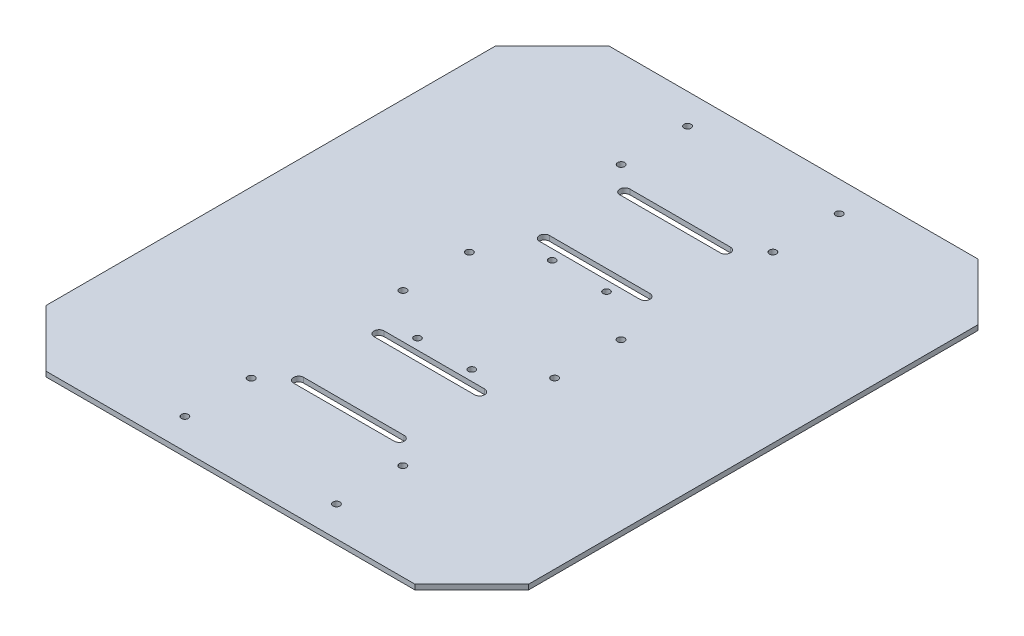
from build123d import *

# Parameters (mm, degrees)
SKETCH1_R           = 2.2225
BOSS_EXTRUDE1_DEPTH = 3.175
SKETCH2_R           = 2.159
CUT_EXTRUDE1_DEPTH  = 297.247830215
CUT_EXTRUDE2_DEPTH  = 297.247830215


with BuildPart() as part:
    # Sketch1 → Boss-Extrude1 (new body)
    with BuildSketch(Plane(origin=(0, 0, 0), x_dir=(1, 0, 0), z_dir=(0, 1, 0))):
        Polygon((-85.365028143, 123.058976948), (-121.286052627, 87.137952464), (-121.286052627, -196.619998567), (-85.365028143, -232.541023052), (147.592922888, -232.541023052), (183.513947373, -196.619998567), (183.513947373, 87.137952464), (147.592922888, 123.058976948), align=None)
        with Locations((-16.765052627, -213.491023052)):
            Circle(SKETCH1_R, mode=Mode.SUBTRACT)
        with Locations((-16.765052627, -171.581023052)):
            Circle(SKETCH1_R, mode=Mode.SUBTRACT)
        with Locations((-16.765052627, -75.696023052)):
            Circle(SKETCH1_R, mode=Mode.SUBTRACT)
        with Locations((78.992947373, -213.491023052)):
            Circle(SKETCH1_R, mode=Mode.SUBTRACT)
        with Locations((78.992947373, -171.581023052)):
            Circle(SKETCH1_R, mode=Mode.SUBTRACT)
        with Locations((78.992947373, -75.696023052)):
            Circle(SKETCH1_R, mode=Mode.SUBTRACT)
        with Locations((-16.765052627, -33.786023052)):
            Circle(SKETCH1_R, mode=Mode.SUBTRACT)
        with Locations((-16.765052627, 62.098976948)):
            Circle(SKETCH1_R, mode=Mode.SUBTRACT)
        with Locations((-16.765052627, 104.008976948)):
            Circle(SKETCH1_R, mode=Mode.SUBTRACT)
        with Locations((78.992947373, -33.786023052)):
            Circle(SKETCH1_R, mode=Mode.SUBTRACT)
        with Locations((78.992947373, 62.098976948)):
            Circle(SKETCH1_R, mode=Mode.SUBTRACT)
        with Locations((78.992947373, 104.008976948)):
            Circle(SKETCH1_R, mode=Mode.SUBTRACT)
    extrude(amount=BOSS_EXTRUDE1_DEPTH)

    # Sketch2 → Cut-Extrude1 (cut, through all)
    with BuildSketch(Plane(origin=(0, 3.175, 0), x_dir=(1, 0, 0), z_dir=(0, 1, 0))):
        with Locations((13.841947373, -12.069023052)):
            Circle(SKETCH2_R)
        with Locations((48.131947373, -12.069023052)):
            Circle(SKETCH2_R)
        with Locations((13.841947373, -97.159023052)):
            Circle(SKETCH2_R)
        with Locations((48.131947373, -97.159023052)):
            Circle(SKETCH2_R)
    extrude(amount=-CUT_EXTRUDE1_DEPTH, mode=Mode.SUBTRACT)

    # Sketch4 → Cut-Extrude2 (cut, through all)
    with BuildSketch(Plane(origin=(0, 3.175, 0), x_dir=(1, 0, 0), z_dir=(0, 1, 0))):
        with BuildLine():
            Line((-0.636052627, 51.430976948), (62.863947373, 51.430976948))
            ThreePointArc((62.863947373, 51.430976948), (66.038947373, 48.255976948), (62.863947373, 45.080976948))
            Line((62.863947373, 45.080976948), (-0.636052627, 45.080976948))
            ThreePointArc((-0.636052627, 45.080976948), (-3.811052627, 48.255976948), (-0.636052627, 51.430976948))
        make_face()
        with BuildLine():
            Line((-0.636052627, 0.630976948), (62.863947373, 0.630976948))
            ThreePointArc((62.863947373, 0.630976948), (66.038947373, -2.544023052), (62.863947373, -5.719023052))
            Line((62.863947373, -5.719023052), (-0.636052627, -5.719023052))
            ThreePointArc((-0.636052627, -5.719023052), (-3.811052627, -2.544023052), (-0.636052627, 0.630976948))
        make_face()
        with BuildLine():
            Line((-0.636052627, -110.113023052), (62.863947373, -110.113023052))
            ThreePointArc((62.863947373, -110.113023052), (66.038947373, -106.938023052), (62.863947373, -103.763023052))
            Line((62.863947373, -103.763023052), (-0.636052627, -103.763023052))
            ThreePointArc((-0.636052627, -103.763023052), (-3.811052627, -106.938023052), (-0.636052627, -110.113023052))
        make_face()
        with BuildLine():
            Line((-0.636052627, -160.913023052), (62.863947373, -160.913023052))
            ThreePointArc((62.863947373, -160.913023052), (66.038947373, -157.738023052), (62.863947373, -154.563023052))
            Line((62.863947373, -154.563023052), (-0.636052627, -154.563023052))
            ThreePointArc((-0.636052627, -154.563023052), (-3.811052627, -157.738023052), (-0.636052627, -160.913023052))
        make_face()
    extrude(amount=-CUT_EXTRUDE2_DEPTH, mode=Mode.SUBTRACT)


solid = part.part
